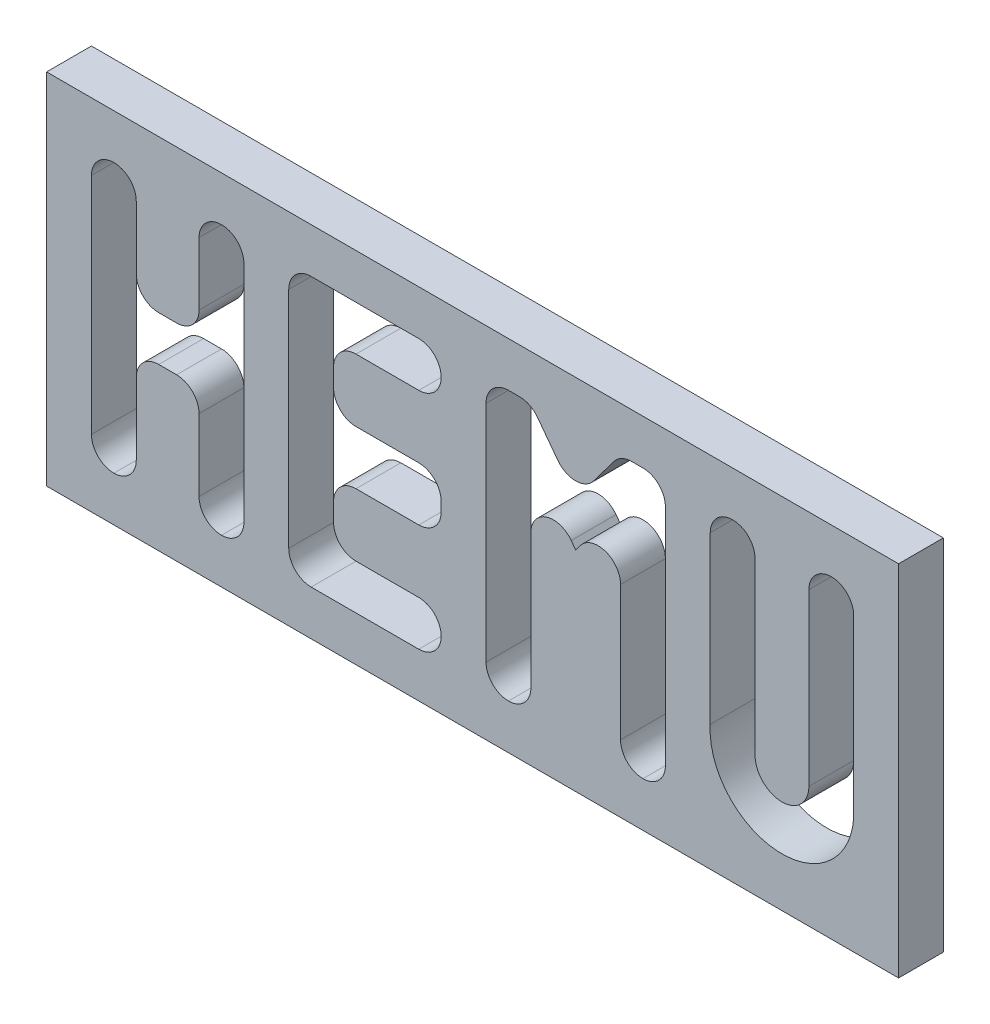
from build123d import *

# Parameters (mm, degrees)
SKETCH1_W           = 190
SKETCH1_H           = 80
BOSS_EXTRUDE1_DEPTH = 10
CUT_EXTRUDE1_DEPTH  = 10
FILLET1_R           = 5


with BuildPart() as part:
    # Sketch1 → Boss-Extrude1 (new body)
    with BuildSketch(Plane.XY):
        Rectangle(SKETCH1_W, SKETCH1_H)
    extrude(amount=BOSS_EXTRUDE1_DEPTH)

    # Sketch2 → Cut-Extrude1 (cut)
    with BuildSketch(Plane.XY):
        Polygon((-75, -30), (-85, -30), (-85, 30), (-75, 30), (-75, 6), (-61, 6), (-61, 30), (-51, 30), (-51, -30), (-61, -30), (-61, -4), (-75, -4), align=None)
        Polygon((-31, 20), (-31, 6), (-7, 6), (-7, -6), (-31, -6), (-31, -20), (-7, -20), (-7, -30), (-41, -30), (-41, 30), (-7, 30), (-7, 20), align=None)
        Polygon((43, -30), (33, -30), (33, 20), (23, 6.666666667), (13, 20), (13, -30), (3, -30), (3, 30), (13, 30), (23, 16.666666667), (33, 30), (43, 30), align=None)
        with BuildLine():
            Line((53, -12), (53, 30))
            Line((53, 30), (63, 30))
            Line((63, 30), (63, -13))
            ThreePointArc((63, -13), (69, -19), (75, -13))
            Line((75, -13), (75, 30))
            Line((75, 30), (85, 30))
            Line((85, 30), (85, -12))
            ThreePointArc((85, -12), (69, -29.031219542), (53, -12))
        make_face()
    extrude(amount=CUT_EXTRUDE1_DEPTH, mode=Mode.SUBTRACT)

    # Fillet1
    fillet1_edges = [part.edges().sort_by_distance(p)[0] for p in [
        (63, 30, 5),
        (53, 30, 5),
        (85, 30, 5),
        (75, 30, 5),
        (-85, -30, 5),
        (-75, -30, 5),
        (-75, -4, 5),
        (-61, -4, 5),
        (-61, -30, 5),
        (-51, -30, 5),
        (-51, 30, 5),
        (-61, 30, 5),
        (-61, 6, 5),
        (-75, 6, 5),
        (-75, 30, 5),
        (-85, 30, 5),
        (-31, 20, 5),
        (-7, 20, 5),
        (-7, 30, 5),
        (-41, 30, 5),
        (-41, -30, 5),
        (-7, -30, 5),
        (-7, -20, 5),
        (-31, -20, 5),
        (-31, -6, 5),
        (-7, -6, 5),
        (-7, 6, 5),
        (-31, 6, 5),
        (13, 20, 5),
        (33, 20, 5),
        (33, -30, 5),
        (43, -30, 5),
        (43, 30, 5),
        (33, 30, 5),
        (23, 16.666666667, 5),
        (13, 30, 5),
        (3, 30, 5),
        (3, -30, 5),
        (13, -30, 5),
    ]]
    fillet(fillet1_edges, radius=FILLET1_R - 0.0001)  # a hair under: the kernel refuses the full size


solid = part.part
